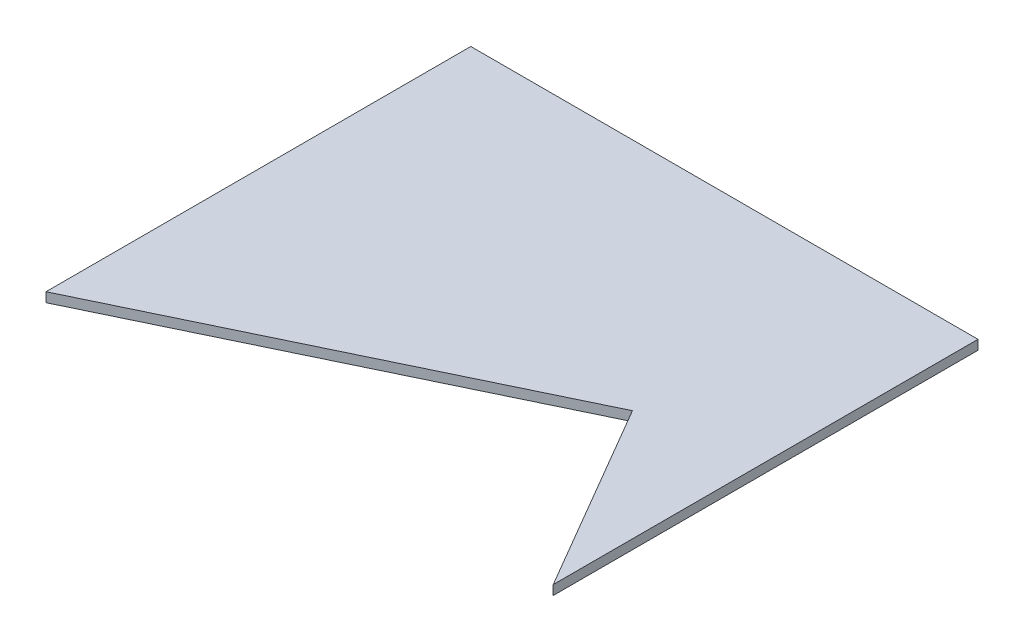
from build123d import *

# Parameters (mm, degrees)
BOSS_EXTRUDE1_DEPTH = 3


with BuildPart() as part:
    # Sketch1 → Boss-Extrude1 (new body)
    with BuildSketch(Plane(origin=(0, 0, 0), x_dir=(1, 0, 0), z_dir=(0, 1, 0))):
        Polygon((-80, -97), (45, -37), (80, -97), (80, 37), (-80, 37), align=None)
    extrude(amount=BOSS_EXTRUDE1_DEPTH)


solid = part.part
